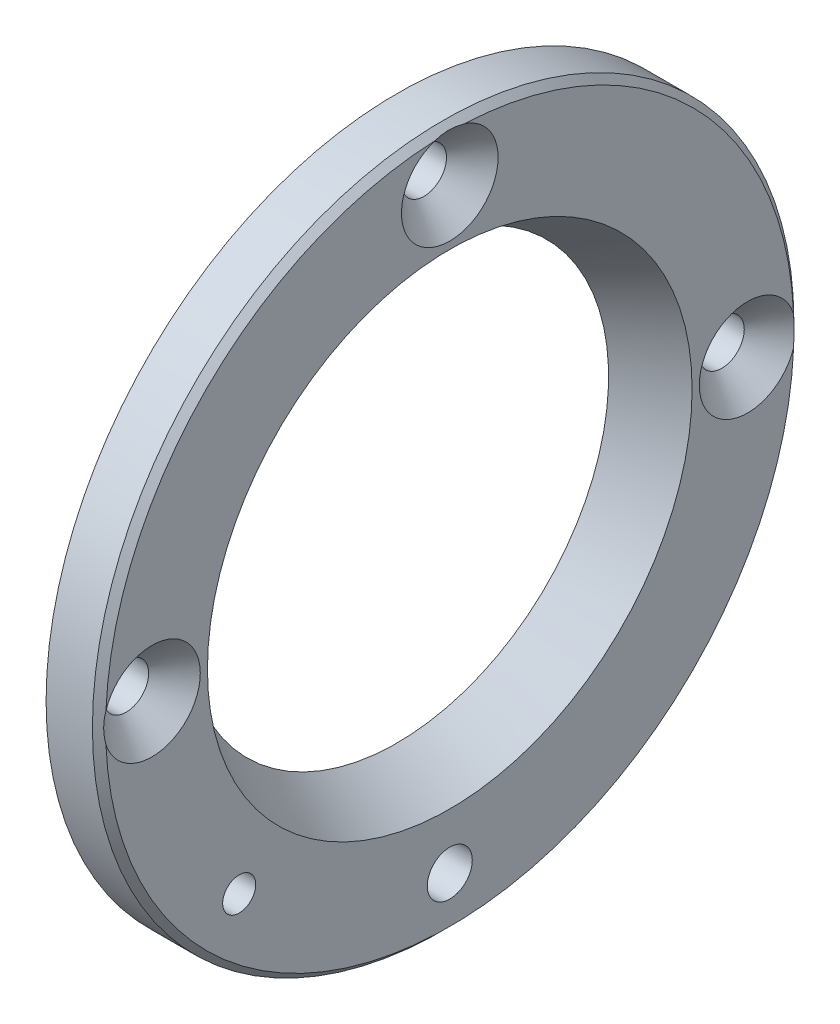
from build123d import *

# Parameters (mm, degrees)
ESQUISSE1_W                                    = 4
ESQUISSE1_H                                    = 10.5
CHANFREIN1_SIZE                                = 2.309401077
CHANFREIN1_SIZE_2                              = 4
ENL_V_MAT_EXTRU_2_REACH                        = 39.69
ESQUISSE7_R                                    = 1.7
FRAISAGE_POUR_VIS_T_TE_FRAIS_E_M31_D           = 3.4
FRAISAGE_POUR_VIS_T_TE_FRAIS_E_M31_CSINK_D     = 7.3
FRAISAGE_POUR_VIS_T_TE_FRAIS_E_M31_CSINK_ANGLE = 90
TROU_TARAUD_M31_D                              = 2.5
CHANFREIN2_SIZE                                = 0.5


with BuildPart() as part:
    # Esquisse1 → Révolution1 (revolve)
    with BuildSketch(Plane.XY, mode=Mode.PRIVATE) as r_volution1_sk:
        with Locations((2, 21.25)):
            Rectangle(ESQUISSE1_W, ESQUISSE1_H)
    revolve(r_volution1_sk.sketch.rotate(Axis((0, 0, 0), (1, 0, 0)), 90), axis=Axis((0, 0, 0), (1, 0, 0)))

    # Chanfrein1
    # the kernel refuses this chamfer: 4, 2.309401077 mm, written as the material it takes off along each edge
    with BuildSketch(Plane(origin=(4, 0, 0), x_dir=(0, 0, 1), z_dir=(0, 1, 0))) as chanfrein1_piece_1:
        Polygon((16 + CHANFREIN1_SIZE, 0), (16, -CHANFREIN1_SIZE_2), (16, 0), align=None)
    revolve(axis=Axis((4, 0, 0), (1, 0, 0)), mode=Mode.SUBTRACT)

    # Esquisse7 → Enlèv. mat.-Extru.2 (cut, up to next)
    with BuildSketch(Plane(origin=(4, 0, 0), x_dir=(0, 0, -1), z_dir=(1, 0, 0)), mode=Mode.PRIVATE) as enl_v_mat_extru_2_sk1:
        with Locations((0, -22.5)):
            Circle(ESQUISSE7_R)
    enl_v_mat_extru_2_tool1 = extrude(enl_v_mat_extru_2_sk1.sketch, amount=-ENL_V_MAT_EXTRU_2_REACH, mode=Mode.PRIVATE) & part.part
    add(enl_v_mat_extru_2_tool1.solids().sort_by_distance((4, -22.5, 0))[0], mode=Mode.SUBTRACT)

    # Fraisage pour vis à tête fraisée M31 (through all)
    with Locations(Plane(origin=(4, 0, 0), x_dir=(0, 0, -1), z_dir=(1, 0, 0))):
        with Locations((0, 22.5), (-22.5, 0), (22.5, 0)):
            CounterSinkHole(FRAISAGE_POUR_VIS_T_TE_FRAIS_E_M31_D / 2, FRAISAGE_POUR_VIS_T_TE_FRAIS_E_M31_CSINK_D / 2, counter_sink_angle=FRAISAGE_POUR_VIS_T_TE_FRAIS_E_M31_CSINK_ANGLE)

    # Trou taraudé M31 (through all)
    with Locations(Plane(origin=(4, 0, 0), x_dir=(0, 0, -1), z_dir=(1, 0, 0))):
        with Locations((-15.909902577, -15.909902577)):
            Hole(TROU_TARAUD_M31_D / 2)

    # Chanfrein2
    # the kernel refuses this chamfer: 0.5 mm, written as the material it takes off along each edge
    with BuildSketch(Plane(origin=(4, 0, 0), x_dir=(0, 0, 1), z_dir=(0, 1, 0))) as chanfrein2_piece_1:
        Polygon((26.5, -CHANFREIN2_SIZE), (26.5 - CHANFREIN2_SIZE, 0), (26.5, 0), align=None)
    revolve(axis=Axis((4, 0, 0), (1, 0, 0)), mode=Mode.SUBTRACT)


solid = part.part
